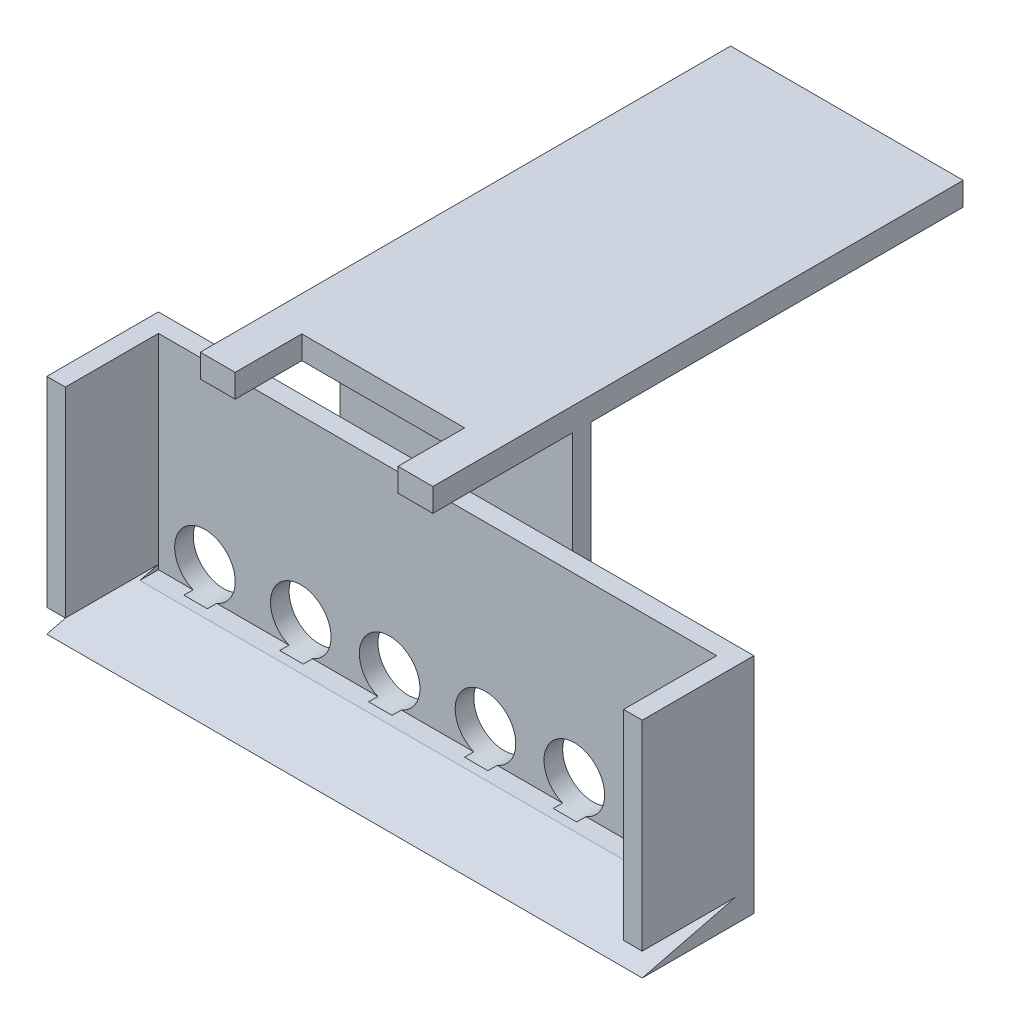
from build123d import *

# Parameters (mm, degrees)
SKETCH1_W               = 152.4
SKETCH1_H               = 25.4
BOSS_EXTRUDE1_DEPTH     = 5.08
BOSS_EXTRUDE2_DEPTH     = 5.08
SKETCH5_W               = 162.56
SKETCH5_H               = 60.96
BOSS_EXTRUDE3_DEPTH     = 5.08
CUT_EXTRUDE2_DEPTH      = 175.522215205
SKETCH7_W               = 63.5
SKETCH7_H               = 38.1
BOSS_EXTRUDE4_DEPTH     = 5.08
BOSS_EXTRUDE5_DEPTH     = 6.35
CUT_EXTRUDE3_REACH      = 178.548
SKETCH9_W               = 44.45
SKETCH9_H               = 39.033619981
CUT_EXTRUDE4_DEPTH      = 2.54
CUT_EXTRUDE4_DEPTH_BACK = 168.837118958
SKETCH10_R              = 8.2696685


with BuildPart() as part:
    # Sketch1 → Boss-Extrude1 (new body)
    with BuildSketch(Plane(origin=(0, 0, 0), x_dir=(1, 0, 0), z_dir=(0, 1, 0))):
        Rectangle(SKETCH1_W, SKETCH1_H)
    extrude(amount=BOSS_EXTRUDE1_DEPTH)

    # Sketch4 → Boss-Extrude2 (add)
    with BuildSketch(Plane(origin=(76.2, 0, 0), x_dir=(0, 0, -1), z_dir=(1, 0, 0))):
        Polygon((-12.7, 0), (-12.7, 5.08), (-12.7, 60.96), (12.7, 60.96), (12.7, 5.08), (12.7, 0), align=None)
    boss_extrude2 = extrude(amount=BOSS_EXTRUDE2_DEPTH)

    # Mirror1: Boss-Extrude2 across plane
    add(boss_extrude2.mirror(Plane(origin=(0, 0, 0), x_dir=(0, 0, 1), z_dir=(1, 0, 0))))

    # Sketch5 → Boss-Extrude3 (add)
    with BuildSketch(Plane(origin=(0, 0, -12.7), x_dir=(-1, 0, 0), z_dir=(0, 0, -1))):
        with Locations((0, 30.48)):
            Rectangle(SKETCH5_W, SKETCH5_H)
    extrude(amount=BOSS_EXTRUDE3_DEPTH)

    # Sketch6 → Cut-Extrude2 (cut, through all)
    with BuildSketch(Plane(origin=(81.28, 0, 0), x_dir=(0, 0, -1), z_dir=(1, 0, 0))):
        Polygon((-12.7, 0), (12.7, 6.35), (-12.7, 6.35), align=None)
    extrude(amount=-CUT_EXTRUDE2_DEPTH, mode=Mode.SUBTRACT)

    # Sketch7 → Boss-Extrude4 (add)
    with BuildSketch(Plane(origin=(0, 0, -17.78), x_dir=(-1, 0, 0), z_dir=(0, 0, -1))):
        with Locations((0, 69.85)):
            Rectangle(SKETCH7_W, SKETCH7_H)
    extrude(amount=BOSS_EXTRUDE4_DEPTH)

    # Sketch8 → Boss-Extrude5 (add)
    with BuildSketch(Plane(origin=(0, 88.9, 0), x_dir=(1, 0, 0), z_dir=(0, 1, 0))):
        Polygon((-31.75, 22.86), (-31.75, 124.46), (31.75, 124.46), (31.75, 22.86), (31.75, 17.78), (31.75, -20.32), (-31.75, -20.32), (-31.75, 17.78), align=None)
    extrude(amount=BOSS_EXTRUDE5_DEPTH)

    # Sketch9 → Cut-Extrude3 (cut, up to next)
    with BuildSketch(Plane(origin=(0, 95.25, 0), x_dir=(1, 0, 0), z_dir=(0, 1, 0)), mode=Mode.PRIVATE) as cut_extrude3_sk1:
        with Locations((0, -21.646832164)):
            Rectangle(SKETCH9_W, SKETCH9_H)
    cut_extrude3_tool1 = extrude(cut_extrude3_sk1.sketch, amount=-CUT_EXTRUDE3_REACH, mode=Mode.PRIVATE) & part.part
    add(cut_extrude3_tool1.solids().sort_by_distance((0, 95.25, 21.646832))[0], mode=Mode.SUBTRACT)

    # Sketch10 → Cut-Extrude4 (cut, two sides: drawn at the far end of the back side and taken through both)
    with BuildSketch(Plane.XY.offset(-12.7).offset(-CUT_EXTRUDE4_DEPTH_BACK)):
        with Locations((-13.081, 12.7)):
            Circle(SKETCH10_R)
        with Locations((13.081, 12.7)):
            Circle(SKETCH10_R)
        with Locations((37.338, 12.7)):
            Circle(SKETCH10_R)
        with Locations((63.5, 12.7)):
            Circle(SKETCH10_R)
        with Locations((-63.5, 12.7)):
            Circle(SKETCH10_R)
        with Locations((-37.338, 12.7)):
            Circle(SKETCH10_R)
    extrude(amount=CUT_EXTRUDE4_DEPTH + CUT_EXTRUDE4_DEPTH_BACK, mode=Mode.SUBTRACT)


solid = part.part
